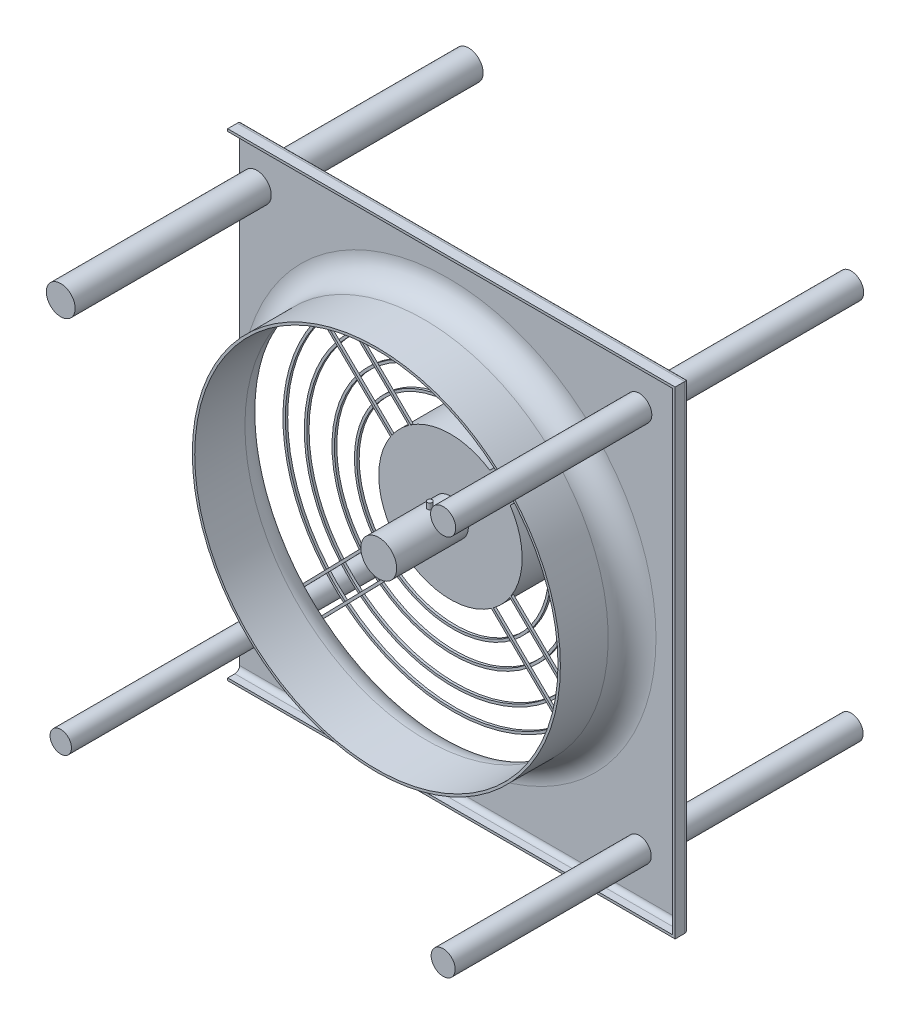
from build123d import *
from OCP.BRepAlgoAPI import BRepAlgoAPI_Cut
from OCP.TopTools import TopTools_ListOfShape

# Parameters (mm, degrees)
SKETCH1_W                = 200
SKETCH1_H                = 200
SKETCH1_R                = 76
BOSS_EXTRUDE1_DEPTH      = 1
SKETCH2_W                = 200
SKETCH2_H                = 200
SKETCH2_W_2              = 198
SKETCH2_H_2              = 198
BOSS_EXTRUDE2_DEPTH      = 5
FILLET1_R                = 2
FILLET2_R                = 2
SKETCH3_R                = 77
SKETCH3_R_2              = 76
BOSS_EXTRUDE3_DEPTH      = 30
FILLET3_R                = 10
F_4_0_4_DIAMETER_HOLE1_D = 4
SKETCH7_R                = 30
BOSS_EXTRUDE4_DEPTH      = 42
FILLET4_R                = 5
SKETCH8_R                = 7.5
BOSS_EXTRUDE5_DEPTH      = 30
EXTRUDE_THIN1_DEPTH      = 1
CIRPATTERN2_COUNT        = 2
CIRPATTERN2_ANGLE        = 90
SKETCH14_R               = 90.340677882
SKETCH14_R_2             = 89.340677882
SKETCH14_R_3             = 71.094775227
SKETCH14_R_4             = 70.094775227
SKETCH14_R_5             = 62.158560732
SKETCH14_R_6             = 61.158560732
SKETCH14_R_7             = 50.566208318
SKETCH14_R_8             = 49.566208318
SKETCH14_R_9             = 41.181735075
SKETCH14_R_10            = 40.181735075
EXTRUDE_THIN2_DEPTH      = 1
SCALE1_SCALE             = 2
SKETCH15_W               = 71.704313835
SKETCH15_H               = 716.070198196
SKETCH15_W_2             = 33.6829906
SKETCH15_H_2             = 636.233898226
CUT_EXTRUDE1_DEPTH       = 672.066
BOSS_EXTRUDE7_DEPTH      = 164.1
BOSS_EXTRUDE7_DEPTH_BACK = 177.301926
SKETCH16_R               = 12.064272727
SKETCH16_R_2             = 10.501873381
SKETCH16_R_3             = 8.954612501
SKETCH16_R_4             = 10.044544868
SKETCH17_W               = 80.806323198
SKETCH17_H               = 449.114339137
CUT_EXTRUDE2_DEPTH       = 38
SKETCH18_R               = 2
BOSS_EXTRUDE8_DEPTH      = 20


with BuildPart() as part:
    # Sketch1 → Boss-Extrude1 (new body)
    with BuildSketch(Plane.XY):
        Rectangle(SKETCH1_W, SKETCH1_H)
        Circle(SKETCH1_R, mode=Mode.SUBTRACT)
    extrude(amount=BOSS_EXTRUDE1_DEPTH)

    # Sketch2 → Boss-Extrude2 (add)
    with BuildSketch(Plane.XY.offset(1)):
        Rectangle(SKETCH2_W, SKETCH2_H)
        Rectangle(SKETCH2_W_2, SKETCH2_H_2, mode=Mode.SUBTRACT)
    extrude(amount=BOSS_EXTRUDE2_DEPTH)

    # Fillet1
    fillet1_edges = [part.edges().sort_by_distance(p)[0] for p in [
        (0, -99, 1),
        (99, 0, 1),
        (0, 99, 1),
        (-99, 0, 1),
    ]]
    fillet(fillet1_edges, radius=FILLET1_R)

    # Fillet2
    fillet2_edges = [part.edges().sort_by_distance(p)[0] for p in [
        (0, -100, 0),
        (-100, 0, 0),
        (0, 100, 0),
        (100, 0, 0),
    ]]
    fillet(fillet2_edges, radius=FILLET2_R)

    # Sketch3 → Boss-Extrude3 (add)
    with BuildSketch(Plane.XY.offset(1)):
        with Locations(Location((0, 0, 0), (0, 0, 180))):
            Circle(SKETCH3_R)
        Circle(SKETCH3_R_2, mode=Mode.SUBTRACT)
    extrude(amount=BOSS_EXTRUDE3_DEPTH)

    # Fillet3
    fillet3_edges = [part.edges().sort_by_distance(p)[0] for p in [
        (-76, 0, 0),
        (77, 0, 1),
    ]]
    fillet(fillet3_edges, radius=FILLET3_R)

    # Ø4.0 (4) Diameter Hole1 (through all)
    with Locations(Plane(origin=(0, 0, 0), x_dir=(-1, 0, 0), z_dir=(0, 0, -1))):
        with Locations((80, 80), (80, -80), (-80, -80), (-80, 80), (0, 0)):
            Hole(F_4_0_4_DIAMETER_HOLE1_D / 2)



with BuildPart() as body_2:
    # Sketch7 → Boss-Extrude4 (new body)
    with BuildSketch(Plane(origin=(0, 0, 0), x_dir=(-1, 0, 0), z_dir=(0, 0, -1))):
        with Locations(Location((0, 0, 0), (0, 0, 180))):
            Circle(SKETCH7_R)
    extrude(amount=BOSS_EXTRUDE4_DEPTH)

    # Fillet4
    fillet4_edges = [body_2.edges().sort_by_distance(p)[0] for p in [
        (-30, 0, -42),
    ]]
    fillet(fillet4_edges, radius=FILLET4_R)

    # Sketch8 → Boss-Extrude5 (add)
    with BuildSketch(Plane.XY):
        with Locations(Location((0, 0, 0), (0, 0, 180))):
            Circle(SKETCH8_R)
    extrude(amount=BOSS_EXTRUDE5_DEPTH)


with BuildPart() as part_1:
    add(part.part)

    add(body_2.part)  # Extrude-Thin1 merges body 2
    # Sketch13 → Extrude-Thin1 (add)
    with BuildSketch(Plane(origin=(0, 0, 0), x_dir=(-1, 0, 0), z_dir=(0, 0, -1))):
        Polygon((-66.869220358, -73.198133007), (73.389853085, 63.597753438), (65.011292278, 72.188429709), (-75.247781166, -64.607456736), align=None)
        Polygon((-66.851544069, -71.784029917), (71.975749995, 63.615429726), (64.993615989, 70.774326619), (-73.833678076, -64.625133024), align=None, mode=Mode.SUBTRACT)
    extrude_thin1 = extrude(amount=EXTRUDE_THIN1_DEPTH)

    # CirPattern2: Extrude-Thin1 ×2 about axis
    cirpattern2_axis = Axis((0, 0, 0), (0, 0, -1))
    for i in range(1, CIRPATTERN2_COUNT):
        add(extrude_thin1.rotate(cirpattern2_axis, i * CIRPATTERN2_ANGLE / (CIRPATTERN2_COUNT - 1)))

    # Sketch14 → Extrude-Thin2 (add)
    # profile 1 of 5: a face of its own
    with BuildSketch(Plane(origin=(0, 0, -1), x_dir=(-1, 0, 0), z_dir=(0, 0, -1))):
        Circle(SKETCH14_R)
        Circle(SKETCH14_R_2, mode=Mode.SUBTRACT)
    # profile 2 of 5: a face of its own
    with BuildSketch(Plane(origin=(0, 0, -1), x_dir=(-1, 0, 0), z_dir=(0, 0, -1))):
        Circle(SKETCH14_R_3)
        Circle(SKETCH14_R_4, mode=Mode.SUBTRACT)
    # profile 3 of 5: a face of its own
    with BuildSketch(Plane(origin=(0, 0, -1), x_dir=(-1, 0, 0), z_dir=(0, 0, -1))):
        Circle(SKETCH14_R_5)
        Circle(SKETCH14_R_6, mode=Mode.SUBTRACT)
    # profile 4 of 5: a face of its own
    with BuildSketch(Plane(origin=(0, 0, -1), x_dir=(-1, 0, 0), z_dir=(0, 0, -1))):
        Circle(SKETCH14_R_7)
        Circle(SKETCH14_R_8, mode=Mode.SUBTRACT)
    # profile 5 of 5: a face of its own
    with BuildSketch(Plane(origin=(0, 0, -1), x_dir=(-1, 0, 0), z_dir=(0, 0, -1))):
        Circle(SKETCH14_R_9)
        Circle(SKETCH14_R_10, mode=Mode.SUBTRACT)
    extrude(amount=EXTRUDE_THIN2_DEPTH)


with BuildPart() as part_2:
    # Scale1: scaled about (0.000773871, -0.00356152, -12.716640756)
    add(part_1.part.scale(SCALE1_SCALE).moved(Location((-0.000773871, 0.00356152, 12.716640756))))

    # Sketch15 → Cut-Extrude1 (cut)
    with BuildSketch(Plane.XY.offset(24.716649316)):
        with Locations((-214.006809876, -26.224596718)):
            Rectangle(SKETCH15_W, SKETCH15_H)
        with Locations((219.686842342, 5.095797886)):
            Rectangle(SKETCH15_W_2, SKETCH15_H_2)
    extrude(amount=-CUT_EXTRUDE1_DEPTH, mode=Mode.SUBTRACT)

    # Sketch16 → Boss-Extrude7 (add, two sides: drawn at the far end of the back side and taken through both)
    with BuildSketch(Plane.XY.offset(14.716649316).offset(-BOSS_EXTRUDE7_DEPTH_BACK)):
        with Locations(Location((-160.000773871, 160.00356152, 0), (0, 0, 180))):
            Circle(SKETCH16_R)
        with Locations(Location((159.999226129, 160.00356152, 0), (0, 0, 180))):
            Circle(SKETCH16_R_2)
        with Locations(Location((-160.000773871, -159.99643848, 0), (0, 0, 180))):
            Circle(SKETCH16_R_3)
        with Locations(Location((159.999226129, -159.99643848, 0), (0, 0, 180))):
            Circle(SKETCH16_R_4)
    extrude(amount=BOSS_EXTRUDE7_DEPTH + BOSS_EXTRUDE7_DEPTH_BACK)


with BuildPart() as cut_extrude2_tool:
    # Sketch17 → Cut-Extrude2 (new body)
    with BuildSketch(Plane(origin=(0, 0, 12.716649316), x_dir=(-1, 0, 0), z_dir=(0, 0, -1))):
        with Locations((214.815772187, -9.393971221)):
            Rectangle(SKETCH17_W, SKETCH17_H)
    extrude(amount=-CUT_EXTRUDE2_DEPTH)


with BuildPart() as part_3:
    add(part_2.part)

    # Cut-Extrude2: cut by cut_extrude2_tool, with a tolerance
    cut_extrude2_stock = TopTools_ListOfShape()
    cut_extrude2_stock.Append(part_3.part.wrapped)
    cut_extrude2_tools = TopTools_ListOfShape()
    cut_extrude2_tools.Append(cut_extrude2_tool.part.wrapped)
    cut_extrude2_cut = BRepAlgoAPI_Cut()
    cut_extrude2_cut.SetArguments(cut_extrude2_stock)
    cut_extrude2_cut.SetTools(cut_extrude2_tools)
    cut_extrude2_cut.SetFuzzyValue(0.00001)
    cut_extrude2_cut.Build()
    add(Compound.cast(cut_extrude2_cut.Shape()).solids(), mode=Mode.REPLACE)

    # Sketch18 → Boss-Extrude8 (add)
    with BuildSketch(Plane(origin=(0, 0, 0), x_dir=(1, 0, 0), z_dir=(0, 1, 0))):
        with Locations(Location((0, -30, 0), (0, 0, 90))):
            Circle(SKETCH18_R)
    extrude(amount=BOSS_EXTRUDE8_DEPTH)


solid = part_3.part
